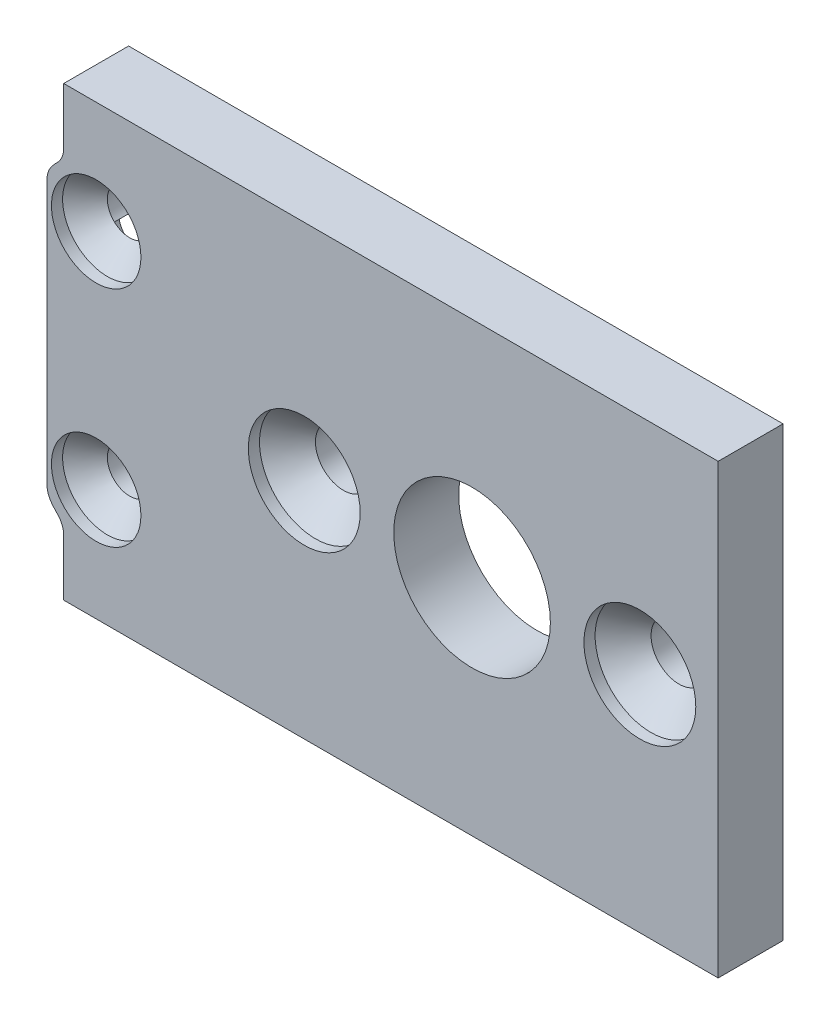
from build123d import *

# Parameters (mm, degrees)
SKETCH1_W                                      = 185
SKETCH1_H                                      = 20
BASE_SHAPE_DEPTH                               = 2.9
MOTOR_CUTOUTS_REACH                            = 95.084
SKETCH2_R                                      = 1.25
SKETCH2_R_2                                    = 3.5
SKETCH2_R_3                                    = 5
MOTOR_M2_5_COUNTERSUNKS_AT_2_COUNT             = 2
MOTOR_M2_5_COUNTERSUNKS_AT_2_PITCH             = 15
MOTOR_M2_5_COUNTERSUNKS_AT_3_COUNT             = 2
MOTOR_M2_5_COUNTERSUNKS_AT_3_PITCH             = 147.666008275
MOTOR_M2_5_COUNTERSUNKS_AT_4_COUNT             = 2
MOTOR_M2_5_COUNTERSUNKS_AT_4_PITCH             = 161.651631603
MOTOR_M2_5_COUNTERSUNKS_AT_5_COUNT             = 2
MOTOR_M2_5_COUNTERSUNKS_AT_5_PITCH             = 147.666008275
MOTOR_M2_5_COUNTERSUNKS_AT_6_COUNT             = 2
MOTOR_M2_5_COUNTERSUNKS_AT_6_PITCH             = 161.651631603
PCB_SLOT_DEPTH                                 = 0.775
END_PLATE_HOLES_REACH                          = 95.084
SKETCH6_R                                      = 1
CSK_FOR_M2_FLAT_HEAD_MACHINE_SCREW3_AT_2_COUNT = 2
CSK_FOR_M2_FLAT_HEAD_MACHINE_SCREW3_AT_2_PITCH = 10
CSK_FOR_M2_FLAT_HEAD_MACHINE_SCREW3_AT_3_COUNT = 2
CSK_FOR_M2_FLAT_HEAD_MACHINE_SCREW3_AT_3_PITCH = 180.6
CSK_FOR_M2_FLAT_HEAD_MACHINE_SCREW3_AT_4_COUNT = 2
CSK_FOR_M2_FLAT_HEAD_MACHINE_SCREW3_AT_4_PITCH = 180.876643047
TAP_START                                      = -1.4
TAP_SLOTS_DEPTH                                = 1.4
CUT_EXTRUDE3_REACH                             = 95.084
FILLET1_R                                      = 1
CUT_EXTRUDE4_REACH                             = 95.084
SKETCH14_W                                     = 155
SKETCH14_H                                     = 20


with BuildPart() as part:
    # Sketch1 → Base shape (new body)
    with BuildSketch(Plane.XY):
        Rectangle(SKETCH1_W, SKETCH1_H)
    extrude(amount=-BASE_SHAPE_DEPTH)

    # Sketch2 → Motor cutouts (cut, up to next)
    with BuildSketch(Plane.XY, mode=Mode.PRIVATE) as motor_cutouts_sk1:
        with Locations((-81, 0)):
            Circle(SKETCH2_R)
    motor_cutouts_tool1 = extrude(motor_cutouts_sk1.sketch, amount=-MOTOR_CUTOUTS_REACH, mode=Mode.PRIVATE) & part.part
    # Sketch2 → Motor cutouts (cut, up to next)
    with BuildSketch(Plane.XY, mode=Mode.PRIVATE) as motor_cutouts_sk2:
        with Locations((-66, 0)):
            Circle(SKETCH2_R)
    motor_cutouts_tool2 = extrude(motor_cutouts_sk2.sketch, amount=-MOTOR_CUTOUTS_REACH, mode=Mode.PRIVATE) & part.part
    # Sketch2 → Motor cutouts (cut, up to next)
    with BuildSketch(Plane.XY, mode=Mode.PRIVATE) as motor_cutouts_sk3:
        with Locations((-73.5, 0)):
            Circle(SKETCH2_R_2)
    motor_cutouts_tool3 = extrude(motor_cutouts_sk3.sketch, amount=-MOTOR_CUTOUTS_REACH, mode=Mode.PRIVATE) & part.part
    # Sketch2 → Motor cutouts (cut, up to next)
    with BuildSketch(Plane.XY, mode=Mode.PRIVATE) as motor_cutouts_sk4:
        with Locations((73.5, 0)):
            Circle(SKETCH2_R_3)
    motor_cutouts_tool4 = extrude(motor_cutouts_sk4.sketch, amount=-MOTOR_CUTOUTS_REACH, mode=Mode.PRIVATE) & part.part
    # Sketch2 → Motor cutouts (cut, up to next)
    with BuildSketch(Plane.XY, mode=Mode.PRIVATE) as motor_cutouts_sk5:
        with Locations((66.5, 7)):
            Circle(SKETCH2_R)
    motor_cutouts_tool5 = extrude(motor_cutouts_sk5.sketch, amount=-MOTOR_CUTOUTS_REACH, mode=Mode.PRIVATE) & part.part
    # Sketch2 → Motor cutouts (cut, up to next)
    with BuildSketch(Plane.XY, mode=Mode.PRIVATE) as motor_cutouts_sk6:
        with Locations((80.5, 7)):
            Circle(SKETCH2_R)
    motor_cutouts_tool6 = extrude(motor_cutouts_sk6.sketch, amount=-MOTOR_CUTOUTS_REACH, mode=Mode.PRIVATE) & part.part
    # Sketch2 → Motor cutouts (cut, up to next)
    with BuildSketch(Plane.XY, mode=Mode.PRIVATE) as motor_cutouts_sk7:
        with Locations((80.5, -7)):
            Circle(SKETCH2_R)
    motor_cutouts_tool7 = extrude(motor_cutouts_sk7.sketch, amount=-MOTOR_CUTOUTS_REACH, mode=Mode.PRIVATE) & part.part
    # Sketch2 → Motor cutouts (cut, up to next)
    with BuildSketch(Plane.XY, mode=Mode.PRIVATE) as motor_cutouts_sk8:
        with Locations((66.5, -7)):
            Circle(SKETCH2_R)
    motor_cutouts_tool8 = extrude(motor_cutouts_sk8.sketch, amount=-MOTOR_CUTOUTS_REACH, mode=Mode.PRIVATE) & part.part
    add(motor_cutouts_tool1.solids().sort_by_distance((-81, 0, 0))[0], mode=Mode.SUBTRACT)
    add(motor_cutouts_tool2.solids().sort_by_distance((-66, 0, 0))[0], mode=Mode.SUBTRACT)
    add(motor_cutouts_tool3.solids().sort_by_distance((-73.5, 0, 0))[0], mode=Mode.SUBTRACT)
    add(motor_cutouts_tool4.solids().sort_by_distance((73.5, 0, 0))[0], mode=Mode.SUBTRACT)
    add(motor_cutouts_tool5.solids().sort_by_distance((66.5, 7, 0))[0], mode=Mode.SUBTRACT)
    add(motor_cutouts_tool6.solids().sort_by_distance((80.5, 7, 0))[0], mode=Mode.SUBTRACT)
    add(motor_cutouts_tool7.solids().sort_by_distance((80.5, -7, 0))[0], mode=Mode.SUBTRACT)
    add(motor_cutouts_tool8.solids().sort_by_distance((66.5, -7, 0))[0], mode=Mode.SUBTRACT)

    # Sketch4 → Motor M2.5 countersunks (revolve, cut)
    with BuildSketch(Plane(origin=(-81, 0, 0), x_dir=(0, -1, 0), z_dir=(1, 0, 0))):
        Polygon((0, 0), (0, 2.9), (1.25, 2.9), (1.25, 1.75), (2.5, 0.5), (2.5, 0), align=None)
    motor_m2_5_countersunks = revolve(axis=Axis((-81, 0, 6.35), (0, 0, -1)), mode=Mode.SUBTRACT)

    # Motor M2.5 countersunks at 2: Motor M2.5 countersunks ×2
    with Locations(*[(i * MOTOR_M2_5_COUNTERSUNKS_AT_2_PITCH, 0, 0) for i in range(1, MOTOR_M2_5_COUNTERSUNKS_AT_2_COUNT)]):
        add(motor_m2_5_countersunks, mode=Mode.SUBTRACT)

    # Motor M2.5 countersunks at 3: Motor M2.5 countersunks ×2
    with Locations(*[Vector(0.9988757854473691, 0.047404274563603965, 0) * (i * MOTOR_M2_5_COUNTERSUNKS_AT_3_PITCH) for i in range(1, MOTOR_M2_5_COUNTERSUNKS_AT_3_COUNT)]):
        add(motor_m2_5_countersunks, mode=Mode.SUBTRACT)

    # Motor M2.5 countersunks at 4: Motor M2.5 countersunks ×2
    with Locations(*[Vector(0.9990619853213468, 0.043302996267798335, 0) * (i * MOTOR_M2_5_COUNTERSUNKS_AT_4_PITCH) for i in range(1, MOTOR_M2_5_COUNTERSUNKS_AT_4_COUNT)]):
        add(motor_m2_5_countersunks, mode=Mode.SUBTRACT)

    # Motor M2.5 countersunks at 5: Motor M2.5 countersunks ×2
    with Locations(*[Vector(0.9988757854473691, -0.04740427456360395, 0) * (i * MOTOR_M2_5_COUNTERSUNKS_AT_5_PITCH) for i in range(1, MOTOR_M2_5_COUNTERSUNKS_AT_5_COUNT)]):
        add(motor_m2_5_countersunks, mode=Mode.SUBTRACT)

    # Motor M2.5 countersunks at 6: Motor M2.5 countersunks ×2
    with Locations(*[Vector(0.9990619853213468, -0.0433029962677983, 0) * (i * MOTOR_M2_5_COUNTERSUNKS_AT_6_PITCH) for i in range(1, MOTOR_M2_5_COUNTERSUNKS_AT_6_COUNT)]):
        add(motor_m2_5_countersunks, mode=Mode.SUBTRACT)

    # Sketch5 → PCB slot (cut)
    with BuildSketch(Plane(origin=(0, 0, -2.9), x_dir=(-1, 0, 0), z_dir=(0, 0, -1))):
        with BuildLine():
            Line((-60, -6), (60, -6))
            ThreePointArc((60, -6), (61, -7), (60, -8))
            Line((60, -8), (-60, -8))
            ThreePointArc((-60, -8), (-61, -7), (-60, -6))
        make_face()
    extrude(amount=-PCB_SLOT_DEPTH, mode=Mode.SUBTRACT)

    # Sketch6 → End plate holes (cut, up to next)
    with BuildSketch(Plane.XY, mode=Mode.PRIVATE) as end_plate_holes_sk1:
        with Locations((90.3, 5)):
            Circle(SKETCH6_R)
    end_plate_holes_tool1 = extrude(end_plate_holes_sk1.sketch, amount=-END_PLATE_HOLES_REACH, mode=Mode.PRIVATE) & part.part
    # Sketch6 → End plate holes (cut, up to next)
    with BuildSketch(Plane.XY, mode=Mode.PRIVATE) as end_plate_holes_sk2:
        with Locations((90.3, -5)):
            Circle(SKETCH6_R)
    end_plate_holes_tool2 = extrude(end_plate_holes_sk2.sketch, amount=-END_PLATE_HOLES_REACH, mode=Mode.PRIVATE) & part.part
    # Sketch6 → End plate holes (cut, up to next)
    with BuildSketch(Plane.XY, mode=Mode.PRIVATE) as end_plate_holes_sk3:
        with Locations((-90.3, -5)):
            Circle(SKETCH6_R)
    end_plate_holes_tool3 = extrude(end_plate_holes_sk3.sketch, amount=-END_PLATE_HOLES_REACH, mode=Mode.PRIVATE) & part.part
    # Sketch6 → End plate holes (cut, up to next)
    with BuildSketch(Plane.XY, mode=Mode.PRIVATE) as end_plate_holes_sk4:
        with Locations((-90.3, 5)):
            Circle(SKETCH6_R)
    end_plate_holes_tool4 = extrude(end_plate_holes_sk4.sketch, amount=-END_PLATE_HOLES_REACH, mode=Mode.PRIVATE) & part.part
    add(end_plate_holes_tool1.solids().sort_by_distance((90.3, 5, 0))[0], mode=Mode.SUBTRACT)
    add(end_plate_holes_tool2.solids().sort_by_distance((90.3, -5, 0))[0], mode=Mode.SUBTRACT)
    add(end_plate_holes_tool3.solids().sort_by_distance((-90.3, -5, 0))[0], mode=Mode.SUBTRACT)
    add(end_plate_holes_tool4.solids().sort_by_distance((-90.3, 5, 0))[0], mode=Mode.SUBTRACT)

    # Sketch9 → CSK for M2 Flat Head Machine Screw3 (revolve, cut)
    with BuildSketch(Plane(origin=(90.3, 5, 0), x_dir=(0, -1, 0), z_dir=(1, 0, 0))):
        Polygon((0, 0), (0, 2.9), (1, 2.9), (1, 1.5), (2, 0.5), (2, 0), align=None)
    csk_for_m2_flat_head_machine_screw3 = revolve(axis=Axis((90.3, 5, 6.35), (0, 0, -1)), mode=Mode.SUBTRACT)

    # CSK for M2 Flat Head Machine Screw3 at 2: CSK for M2 Flat Head Machine Screw3 ×2
    with Locations(*[(0, -i * CSK_FOR_M2_FLAT_HEAD_MACHINE_SCREW3_AT_2_PITCH, 0) for i in range(1, CSK_FOR_M2_FLAT_HEAD_MACHINE_SCREW3_AT_2_COUNT)]):
        add(csk_for_m2_flat_head_machine_screw3, mode=Mode.SUBTRACT)

    # CSK for M2 Flat Head Machine Screw3 at 3: CSK for M2 Flat Head Machine Screw3 ×2
    with Locations(*[(-i * CSK_FOR_M2_FLAT_HEAD_MACHINE_SCREW3_AT_3_PITCH, 0, 0) for i in range(1, CSK_FOR_M2_FLAT_HEAD_MACHINE_SCREW3_AT_3_COUNT)]):
        add(csk_for_m2_flat_head_machine_screw3, mode=Mode.SUBTRACT)

    # CSK for M2 Flat Head Machine Screw3 at 4: CSK for M2 Flat Head Machine Screw3 ×2
    with Locations(*[Vector(-0.9984705430039356, -0.055286298062233535, 0) * (i * CSK_FOR_M2_FLAT_HEAD_MACHINE_SCREW3_AT_4_PITCH) for i in range(1, CSK_FOR_M2_FLAT_HEAD_MACHINE_SCREW3_AT_4_COUNT)]):
        add(csk_for_m2_flat_head_machine_screw3, mode=Mode.SUBTRACT)

    # Sketch12 → Tap slots (cut)
    with BuildSketch(Plane(origin=(0, 0, -2.9), x_dir=(-1, 0, 0), z_dir=(0, 0, -1)).offset(TAP_START)):
        with BuildLine():
            ThreePointArc((-90.984432764, 4.270924015), (-92.07157644, 3.770298494), (-91.9, 2.585786438))
            Line((-91.9, 2.585786438), (-91.9, -2.585786438))
            ThreePointArc((-91.9, -2.585786438), (-92.07157644, -3.770298494), (-90.984432764, -4.270924015))
            ThreePointArc((-90.984432764, -4.270924015), (-90.3, -6), (-89.615567236, -4.270924015))
            ThreePointArc((-89.615567236, -4.270924015), (-88.52842356, -3.770298494), (-88.7, -2.585786438))
            Line((-88.7, -2.585786438), (-88.7, 2.585786438))
            ThreePointArc((-88.7, 2.585786438), (-88.52842356, 3.770298494), (-89.615567236, 4.270924015))
            ThreePointArc((-89.615567236, 4.270924015), (-90.3, 6), (-90.984432764, 4.270924015))
        make_face()
        with BuildLine():
            ThreePointArc((90.984432764, -4.270924015), (92.07157644, -3.770298494), (91.9, -2.585786438))
            Line((91.9, -2.585786438), (91.9, 2.585786438))
            ThreePointArc((91.9, 2.585786438), (92.07157644, 3.770298494), (90.984432764, 4.270924015))
            ThreePointArc((90.984432764, 4.270924015), (90.3, 6), (89.615567236, 4.270924015))
            ThreePointArc((89.615567236, 4.270924015), (88.52842356, 3.770298494), (88.7, 2.585786438))
            Line((88.7, 2.585786438), (88.7, -2.585786438))
            ThreePointArc((88.7, -2.585786438), (88.52842356, -3.770298494), (89.615567236, -4.270924015))
            ThreePointArc((89.615567236, -4.270924015), (90.3, -6), (90.984432764, -4.270924015))
        make_face()
    extrude(amount=TAP_SLOTS_DEPTH, mode=Mode.SUBTRACT)

    # Sketch13 → Cut-Extrude3 (cut, up to next)
    with BuildSketch(Plane.XY, mode=Mode.PRIVATE) as cut_extrude3_sk1:
        with BuildLine():
            Line((-91.75, 10), (-92.5, 10))
            Line((-92.5, 10), (-92.5, 6.187434209))
            ThreePointArc((-92.5, 6.187434209), (-92.173731748, 6.655031521), (-91.75, 7.036541185))
            Line((-91.75, 7.036541185), (-91.75, 10))
        make_face()
    cut_extrude3_tool1 = extrude(cut_extrude3_sk1.sketch, amount=-CUT_EXTRUDE3_REACH, mode=Mode.PRIVATE) & part.part
    # Sketch13 → Cut-Extrude3 (cut, up to next)
    with BuildSketch(Plane.XY, mode=Mode.PRIVATE) as cut_extrude3_sk2:
        with BuildLine():
            Line((92.5, 10), (91.75, 10))
            Line((91.75, 10), (91.75, 7.036541185))
            ThreePointArc((91.75, 7.036541185), (92.173731748, 6.655031521), (92.5, 6.187434209))
            Line((92.5, 6.187434209), (92.5, 10))
        make_face()
    cut_extrude3_tool2 = extrude(cut_extrude3_sk2.sketch, amount=-CUT_EXTRUDE3_REACH, mode=Mode.PRIVATE) & part.part
    # Sketch13 → Cut-Extrude3 (cut, up to next)
    with BuildSketch(Plane.XY, mode=Mode.PRIVATE) as cut_extrude3_sk3:
        with BuildLine():
            ThreePointArc((-91.75, -7.036541185), (-92.173731748, -6.655031521), (-92.5, -6.187434209))
            Line((-92.5, -6.187434209), (-92.5, -10))
            Line((-92.5, -10), (-91.75, -10))
            Line((-91.75, -10), (-91.75, -7.036541185))
        make_face()
    cut_extrude3_tool3 = extrude(cut_extrude3_sk3.sketch, amount=-CUT_EXTRUDE3_REACH, mode=Mode.PRIVATE) & part.part
    # Sketch13 → Cut-Extrude3 (cut, up to next)
    with BuildSketch(Plane.XY, mode=Mode.PRIVATE) as cut_extrude3_sk4:
        with BuildLine():
            ThreePointArc((92.5, -6.187434209), (92.173731748, -6.655031521), (91.75, -7.036541185))
            Line((91.75, -7.036541185), (91.75, -10))
            Line((91.75, -10), (92.5, -10))
            Line((92.5, -10), (92.5, -6.187434209))
        make_face()
    cut_extrude3_tool4 = extrude(cut_extrude3_sk4.sketch, amount=-CUT_EXTRUDE3_REACH, mode=Mode.PRIVATE) & part.part
    add(cut_extrude3_tool1.solids().sort_by_distance((-92.140588, 8.330084, 0))[0], mode=Mode.SUBTRACT)
    add(cut_extrude3_tool2.solids().sort_by_distance((92.140588, 8.330084, 0))[0], mode=Mode.SUBTRACT)
    add(cut_extrude3_tool3.solids().sort_by_distance((-92.140588, -8.330084, 0))[0], mode=Mode.SUBTRACT)
    add(cut_extrude3_tool4.solids().sort_by_distance((92.140588, -8.330084, 0))[0], mode=Mode.SUBTRACT)

    # Fillet1
    fillet1_edges = [part.edges().sort_by_distance(p)[0] for p in [
        (-91.75, -7.036541185, -1.45),
        (-92.5, -6.187434209, -1.45),
        (-92.5, 6.187434209, -1.45),
        (-91.75, 7.036541185, -1.45),
        (92.5, 6.187434209, -1.45),
        (91.75, 7.036541185, -1.45),
        (92.5, -6.187434209, -1.45),
        (91.75, -7.036541185, -1.45),
    ]]
    fillet(fillet1_edges, radius=FILLET1_R)

    # Sketch14 → Cut-Extrude4 (cut, up to next)
    with BuildSketch(Plane.XY, mode=Mode.PRIVATE) as cut_extrude4_sk1:
        with Locations((15, 0)):
            Rectangle(SKETCH14_W, SKETCH14_H)
    cut_extrude4_tool1 = extrude(cut_extrude4_sk1.sketch, amount=-CUT_EXTRUDE4_REACH, mode=Mode.PRIVATE) & part.part
    add(cut_extrude4_tool1.solids().sort_by_distance((15, 0, 0))[0], mode=Mode.SUBTRACT)


solid = part.part
